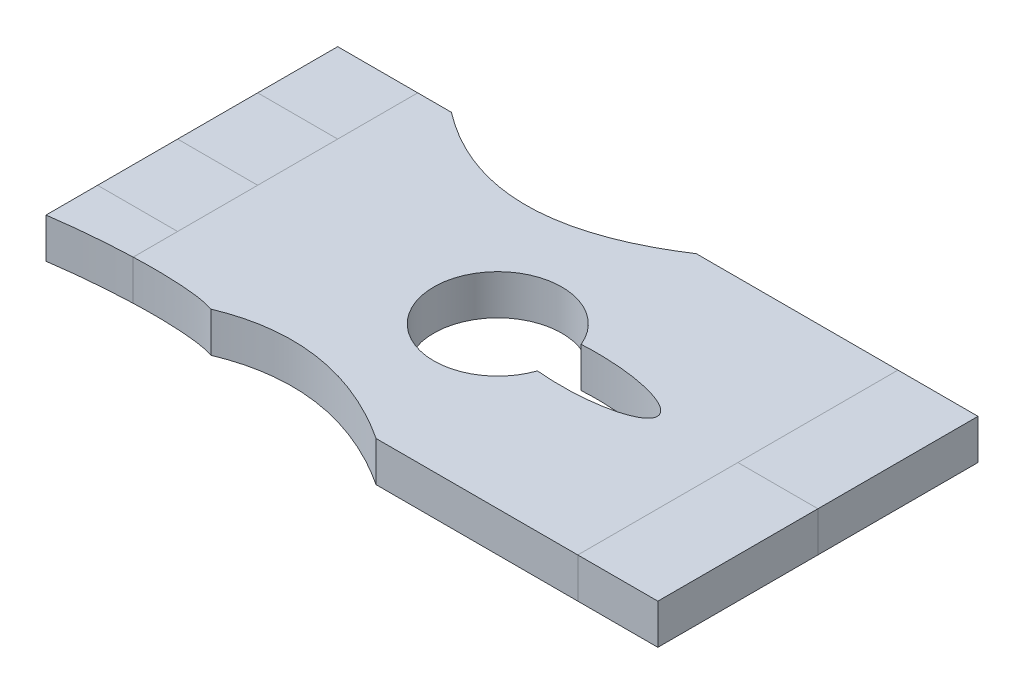
from build123d import *

# Parameters (mm, degrees)
SKETCH1_W           = 38.1
SKETCH1_H           = 25.4
SKETCH1_R           = 5.08
BOSS_EXTRUDE1_DEPTH = 3.175
SKETCH2_W           = 6.35
SKETCH2_H           = 3.175
BOSS_EXTRUDE3_DEPTH = 6.35
SKETCH2_4_W         = 6.35
SKETCH2_4_H         = 3.175
BOSS_EXTRUDE4_DEPTH = 6.35
SKETCH2_6_W         = 6.35
SKETCH2_6_H         = 3.175
BOSS_EXTRUDE6_DEPTH = 6.35
SKETCH2_7_W         = 6.35
SKETCH2_7_H         = 3.175
BOSS_EXTRUDE7_DEPTH = 6.35
SKETCH4_W           = 12.7
SKETCH4_H           = 3.175
BOSS_EXTRUDE8_DEPTH = 6.35
SKETCH4_3_W         = 12.7
SKETCH4_3_H         = 3.175
BOSS_EXTRUDE9_DEPTH = 6.35
CUT_EXTRUDE2_START  = -3.175
CUT_EXTRUDE2_DEPTH  = 3.175
SKETCH8_RX          = 10.678619867
SKETCH8_RY          = 1.879818627
CUT_EXTRUDE3_DEPTH  = 29.575000056
SKETCH9_RX          = 6.310379454
SKETCH9_RY          = 1.838996288
CUT_EXTRUDE4_DEPTH  = 29.575000211


# Read off the part's stored shape, not the designer's step: Cut-Extrude2
with BuildPart() as part:
    # Sketch1 → Boss-Extrude1 (new body)
    with BuildSketch(Plane(origin=(0, 0, 0), x_dir=(1, 0, 0), z_dir=(0, 1, 0))):
        Rectangle(SKETCH1_W, SKETCH1_H)
        with Locations(Location((0, 0, 0), (0, 0, 270))):
            Circle(SKETCH1_R, mode=Mode.SUBTRACT)
    extrude(amount=BOSS_EXTRUDE1_DEPTH)

    # Cut-Extrude2 outline → Cut-Extrude2 (cut)
    with BuildSketch(Plane(origin=(0, 3.175, 0), x_dir=(1, 0, 0), z_dir=(0, 1, 0)).offset(CUT_EXTRUDE2_START)):
        with BuildLine():
            add(Edge.make_bspline(
                [(-16.381459426, -12.7), (-7.418069757, -5.843770377), (3.048928821, -12.7)],
                knots=[0, 0, 0, 1, 1, 1], degree=2))
            Line((-16.381459426, -12.7), (3.048928821, -12.7))
        make_face()
    cut_extrude2 = extrude(amount=CUT_EXTRUDE2_DEPTH, mode=Mode.SUBTRACT)

    # Mirror1: Cut-Extrude2 across plane
    add(cut_extrude2.mirror(Plane.XY), mode=Mode.SUBTRACT)


with BuildPart() as body_2:
    # Sketch2 → Boss-Extrude3 (new body)
    with BuildSketch(Plane.ZY.offset(19.05)):
        with Locations((-9.525, 1.5875)):
            Rectangle(SKETCH2_W, SKETCH2_H)
    extrude(amount=BOSS_EXTRUDE3_DEPTH)


with BuildPart() as body_3:
    # Sketch2<4> → Boss-Extrude4 (new body)
    with BuildSketch(Plane.ZY.offset(19.05)):
        with Locations((-3.175, 1.5875)):
            Rectangle(SKETCH2_4_W, SKETCH2_4_H)
    extrude(amount=BOSS_EXTRUDE4_DEPTH)


with BuildPart() as body_4:
    # Sketch2<6> → Boss-Extrude6 (new body)
    with BuildSketch(Plane.ZY.offset(19.05)):
        with Locations((3.175, 1.5875)):
            Rectangle(SKETCH2_6_W, SKETCH2_6_H)
    extrude(amount=BOSS_EXTRUDE6_DEPTH)


with BuildPart() as body_5:
    # Sketch2<7> → Boss-Extrude7 (new body)
    with BuildSketch(Plane.ZY.offset(19.05)):
        with Locations((9.525, 1.5875)):
            Rectangle(SKETCH2_7_W, SKETCH2_7_H)
    extrude(amount=BOSS_EXTRUDE7_DEPTH)


with BuildPart() as body_6:
    # Sketch4 → Boss-Extrude8 (new body)
    with BuildSketch(Plane(origin=(19.05, 0, 0), x_dir=(0, 0, -1), z_dir=(1, 0, 0))):
        with Locations((-6.35, 1.5875)):
            Rectangle(SKETCH4_W, SKETCH4_H)
    extrude(amount=BOSS_EXTRUDE8_DEPTH)


with BuildPart() as body_7:
    # Sketch4<3> → Boss-Extrude9 (new body)
    with BuildSketch(Plane(origin=(19.05, 0, 0), x_dir=(0, 0, -1), z_dir=(1, 0, 0))):
        with Locations((6.35, 1.5875)):
            Rectangle(SKETCH4_3_W, SKETCH4_3_H)
    extrude(amount=BOSS_EXTRUDE9_DEPTH)


with BuildPart() as cut_extrude3_tool:
    # Sketch8 → Cut-Extrude3 (new, through all)
    with BuildSketch(Plane(origin=(0, 3.175, 0), x_dir=(1, 0, 0), z_dir=(0, 1, 0))):
        with Locations(Location((-22.219604707, -11.957904728), (0, 0, 5.292695502))):
            Ellipse(SKETCH8_RX, SKETCH8_RY)
    extrude(amount=-CUT_EXTRUDE3_DEPTH)


with BuildPart() as part_1:
    add(part.part)

    # Cut-Extrude3: cut by cut_extrude3_tool
    add(cut_extrude3_tool.part, mode=Mode.SUBTRACT)

    # Sketch9 → Cut-Extrude4 (cut, through all)
    with BuildSketch(Plane(origin=(0, 3.175, 0), x_dir=(1, 0, 0), z_dir=(0, 1, 0))):
        with Locations(Location((6.373000309, 0.095873626), (0, 0, 178.839260522))):
            Ellipse(SKETCH9_RX, SKETCH9_RY)
    extrude(amount=-CUT_EXTRUDE4_DEPTH, mode=Mode.SUBTRACT)


with BuildPart() as body_5_1:
    add(body_5.part)

    # Cut-Extrude3: cut by cut_extrude3_tool
    add(cut_extrude3_tool.part, mode=Mode.SUBTRACT)


solid = Compound([body_2.part, body_3.part, body_4.part, body_6.part, body_7.part, part_1.part, body_5_1.part])
